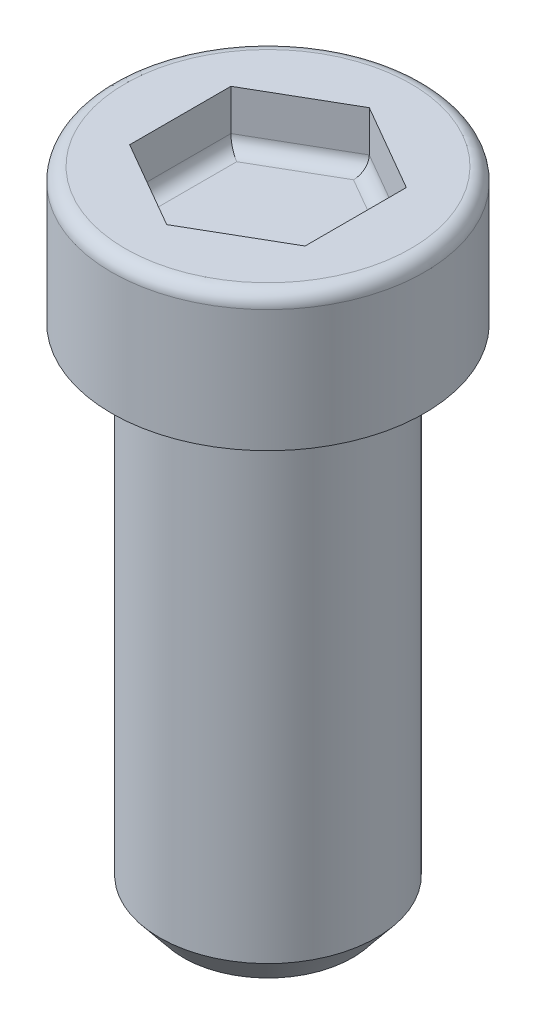
from build123d import *

# Parameters (mm, degrees)
ENL_V_MAT_EXTRU_1_DEPTH = 2
CONG_1_R                = 0.5


with BuildPart() as part:
    # Esquisse1 → Révolution1 (revolve)
    with BuildSketch(Plane(origin=(-222.928713314, 0, 0), x_dir=(0, 0, -1), z_dir=(1, 0, 0))):
        with BuildLine():
            Line((-50, -43.710688376), (-46.904592646, -43.710688376))
            Line((-46.904592646, -43.710688376), (-46.025473943, -42.631388566))
            Line((-46.025473943, -42.631388566), (-46.025473943, -25.110839698))
            Line((-46.025473943, -25.110839698), (-44.266122039, -25.110839698))
            Line((-44.266122039, -25.110839698), (-44.266122039, -20.633627397))
            ThreePointArc((-44.266122039, -20.633627397), (-44.412568648, -20.280074006), (-44.766122039, -20.133627397))
            Line((-44.766122039, -20.133627397), (-50, -20.133627397))
            Line((-50, -20.133627397), (-50, -25.110839698))
            Line((-50, -25.110839698), (-50, -43.710688376))
        make_face()
    revolve(axis=Axis((-222.928713314, -25.110839698, 50), (0, -1, 0)))

    # Esquisse2 → Enlèv. mat.-Extru.1 (cut)
    with BuildSketch(Plane(origin=(0, -20.133627397, 0), x_dir=(1, 0, 0), z_dir=(0, 1, 0))):
        Polygon((-222.928713314, -46.289054486), (-226.142486402, -48.144527243), (-226.142486402, -51.855472757), (-222.928713314, -53.710945514), (-219.714940227, -51.855472757), (-219.714940227, -48.144527243), align=None)
    extrude(amount=-ENL_V_MAT_EXTRU_1_DEPTH, mode=Mode.SUBTRACT)

    # Congé1
    cong_1_edges = [part.edges().sort_by_distance(p)[0] for p in [
        (-219.714940227, -22.133627397, 50),
        (-221.32182677, -22.133627397, 52.783209136),
        (-224.535599858, -22.133627397, 52.783209136),
        (-226.142486402, -22.133627397, 50),
        (-224.535599858, -22.133627397, 47.216790864),
        (-221.32182677, -22.133627397, 47.216790864),
    ]]
    fillet(cong_1_edges, radius=CONG_1_R)


solid = part.part
